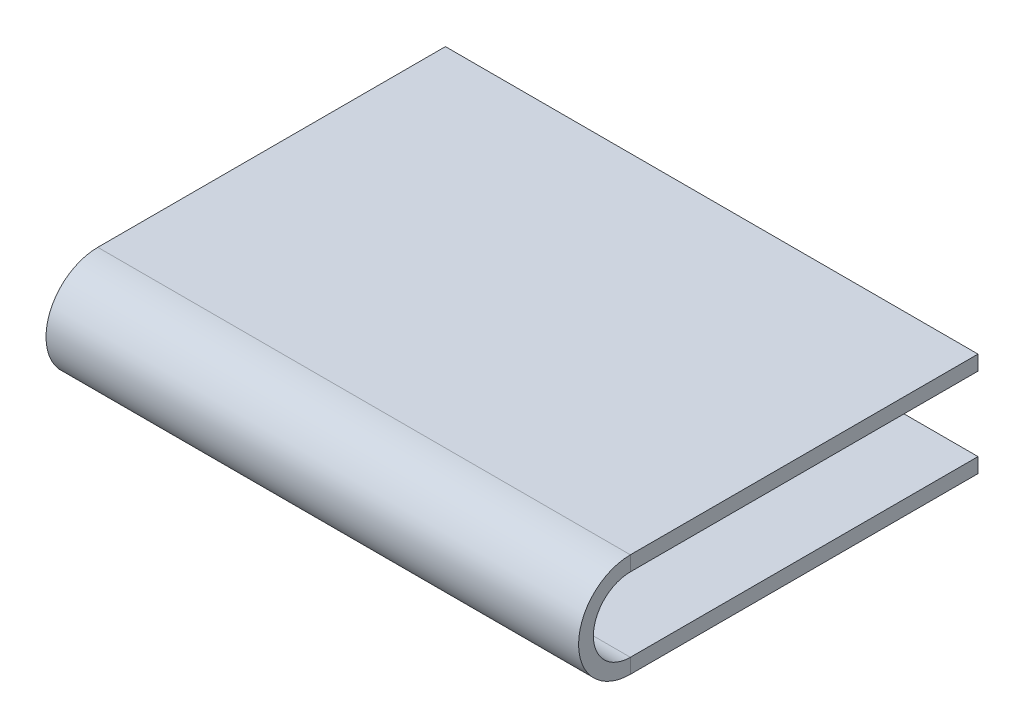
from build123d import *

# Parameters (mm, degrees)
TABAN_FLAN_1_DEPTH = 36


# Sheet-metal steps are written as plain solids
with BuildPart() as part:
    # Çizim1 → Taban-Flanş1 (new body)
    with BuildSketch(Plane.YZ):
        with BuildLine():
            Line((0, 0), (0, 23.5))
            ThreePointArc((0, 23.5), (2.5, 26), (5, 23.5))
            Line((5, 23.5), (5, 0))
            Line((5, 0), (6, 0))
            Line((6, 0), (6, 23.5))
            ThreePointArc((6, 23.5), (2.5, 27), (-1, 23.5))
            Line((-1, 23.5), (-1, 0))
            Line((-1, 0), (0, 0))
        make_face()
    extrude(amount=TABAN_FLAN_1_DEPTH)


solid = part.part
